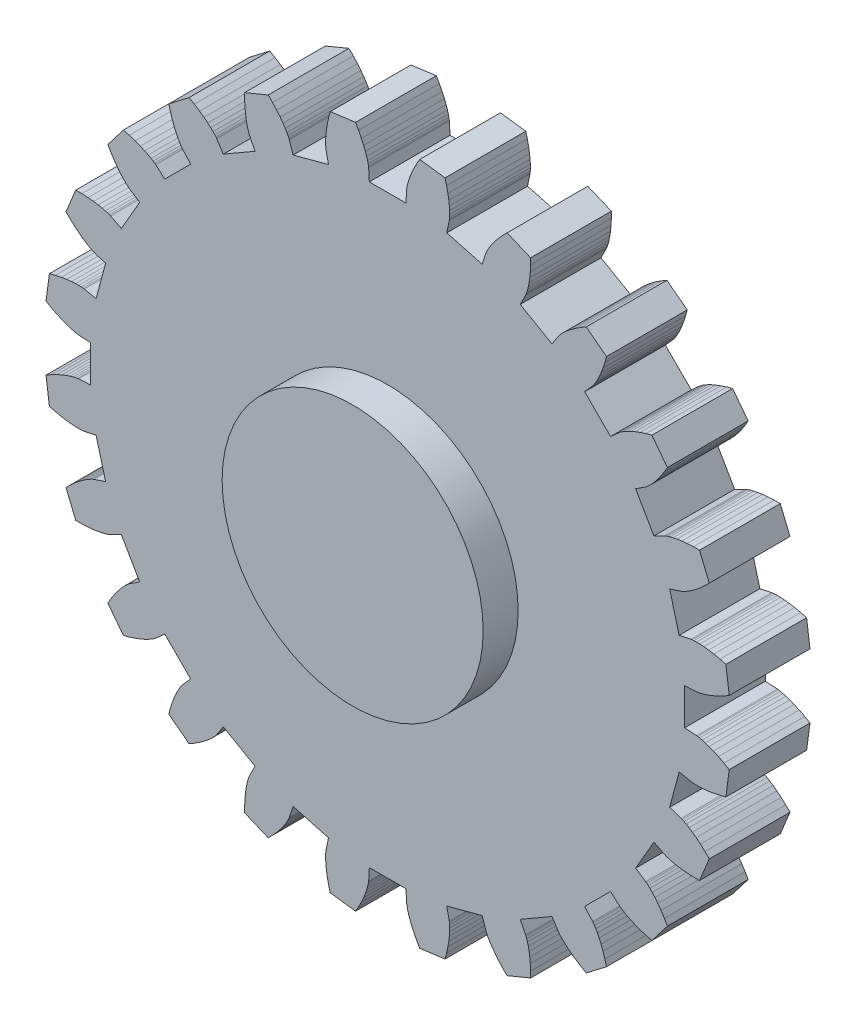
from build123d import *

# Parameters (mm, degrees)
MAIN_GEAR_BODY_DEPTH         = 3
CENTRAL_FEATURE_DEPTH        = 1.3
CENTRAL_FEATURE_DEPTH_BACK   = 4.3
SKETCH2_R                    = 5
SKETCH3_OUTSIDE_W            = 34.792
SKETCH3_OUTSIDE_H            = 34.792
TEETH_CLEARANCE_DEPTH        = 19.532451432
SKETCH4_R                    = 5
SKETCH4_R_2                  = 4.85
PRINT_CLEARANCE_TOP_DEPTH    = 1.3
PRINT_START                  = -1.3
SKETCH6_R                    = 5
SKETCH6_R_2                  = 4.85
PRINT_CLEARANCE_BOTTOM_DEPTH = 1.3


with BuildPart() as part:
    # Model → Main Gear Body (new body)
    with BuildSketch(Plane.XY):
        Polygon((11.481280763, -0.655890262), (11.081931867, -0.633076687), (11.081931867, 0.633076687), (11.481280763, 0.655890262), (11.494959484, 0.657119822), (11.535795525, 0.662587053), (11.603342457, 0.674939875), (11.696960474, 0.69678954), (11.81581907, 0.730698092), (11.958900465, 0.779166001), (12.125003794, 0.844620031), (12.312750022, 0.929401369), (12.520587586, 1.035754071), (12.746798737, 1.165813859), (12.614196933, 2.173024562), (12.36203179, 2.240104916), (12.133750014, 2.289041418), (11.930458058, 2.322341602), (11.753073814, 2.342574636), (11.602323381, 2.352358851), (11.478738615, 2.354349128), (11.382655444, 2.351224158), (11.314212973, 2.345673635), (11.273353363, 2.34038543), (11.259822499, 2.338032781), (10.868176499, 2.256709902), (10.540471892, 3.479720146), (10.920308717, 3.605115467), (10.933203113, 3.609843444), (10.971232676, 3.625693529), (11.033280856, 3.655107871), (11.118053808, 3.700443153), (11.224086216, 3.763959167), (11.349747813, 3.847807762), (11.493250558, 3.954022205), (11.652656464, 4.084506989), (11.82588603, 4.24102813), (12.010727273, 4.425203993), (11.621958453, 5.36377495), (11.361023956, 5.363304455), (11.127854994, 5.351489815), (10.922871322, 5.331039494), (10.746294605, 5.304672682), (10.598148527, 5.275106425), (10.478259688, 5.245042794), (10.386259274, 5.21715615), (10.321585504, 5.194080542), (10.28348684, 5.178397283), (10.27102594, 5.172622753), (9.913772864, 4.99270544), (9.280696176, 6.089226427), (9.615135678, 6.30865801), (9.626367017, 6.316562201), (9.658998451, 6.341714983), (9.711319399, 6.386186306), (9.781470148, 6.45191768), (9.867450435, 6.540712645), (9.967128604, 6.654227783), (10.078251291, 6.7939643), (10.198453625, 6.961260207), (10.325269884, 7.157283131), (10.456144594, 7.383023787), (9.837702711, 8.18899294), (9.585781114, 8.121003659), (9.363615046, 8.049243025), (9.170908956, 7.976435853), (9.007173178, 7.905266052), (8.871727365, 7.838364214), (8.76370468, 7.778295462), (8.682056698, 7.727547573), (8.625559041, 7.688519444), (8.592817683, 7.663509918), (8.582275936, 7.654707033), (8.28376199, 7.388456353), (7.388456353, 8.28376199), (7.654707033, 8.582275936), (7.663509918, 8.592817683), (7.688519444, 8.625559041), (7.727547573, 8.682056698), (7.778295462, 8.76370468), (7.838364214, 8.871727365), (7.905266052, 9.007173178), (7.976435853, 9.170908956), (8.049243025, 9.363615046), (8.121003659, 9.585781114), (8.18899294, 9.837702711), (7.383023787, 10.456144594), (7.157283131, 10.325269884), (6.961260207, 10.198453625), (6.7939643, 10.078251291), (6.654227783, 9.967128604), (6.540712645, 9.867450435), (6.45191768, 9.781470148), (6.386186306, 9.711319399), (6.341714983, 9.658998451), (6.316562201, 9.626367017), (6.30865801, 9.615135678), (6.089226427, 9.280696176), (4.99270544, 9.913772864), (5.172622753, 10.27102594), (5.178397283, 10.28348684), (5.194080542, 10.321585504), (5.21715615, 10.386259274), (5.245042794, 10.478259688), (5.275106425, 10.598148527), (5.304672682, 10.746294605), (5.331039494, 10.922871322), (5.351489815, 11.127854994), (5.363304455, 11.361023956), (5.36377495, 11.621958453), (4.425203993, 12.010727273), (4.24102813, 11.82588603), (4.084506989, 11.652656464), (3.954022205, 11.493250558), (3.847807762, 11.349747813), (3.763959167, 11.224086216), (3.700443153, 11.118053808), (3.655107871, 11.033280856), (3.625693529, 10.971232676), (3.609843444, 10.933203113), (3.605115467, 10.920308717), (3.479720146, 10.540471892), (2.256709902, 10.868176499), (2.338032781, 11.259822499), (2.34038543, 11.273353363), (2.345673635, 11.314212973), (2.351224158, 11.382655444), (2.354349128, 11.478738615), (2.352358851, 11.602323381), (2.342574636, 11.753073814), (2.322341602, 11.930458058), (2.289041418, 12.133750014), (2.240104916, 12.36203179), (2.173024562, 12.614196933), (1.165813859, 12.746798737), (1.035754071, 12.520587586), (0.929401369, 12.312750022), (0.844620031, 12.125003794), (0.779166001, 11.958900465), (0.730698092, 11.81581907), (0.69678954, 11.696960474), (0.674939875, 11.603342457), (0.662587053, 11.535795525), (0.657119822, 11.494959484), (0.655890262, 11.481280763), (0.633076687, 11.081931867), (-0.633076687, 11.081931867), (-0.655890262, 11.481280763), (-0.657119822, 11.494959484), (-0.662587053, 11.535795525), (-0.674939875, 11.603342457), (-0.69678954, 11.696960474), (-0.730698092, 11.81581907), (-0.779166001, 11.958900465), (-0.844620031, 12.125003794), (-0.929401369, 12.312750022), (-1.035754071, 12.520587586), (-1.165813859, 12.746798737), (-2.173024562, 12.614196933), (-2.240104916, 12.36203179), (-2.289041418, 12.133750014), (-2.322341602, 11.930458058), (-2.342574636, 11.753073814), (-2.352358851, 11.602323381), (-2.354349128, 11.478738615), (-2.351224158, 11.382655444), (-2.345673635, 11.314212973), (-2.34038543, 11.273353363), (-2.338032781, 11.259822499), (-2.256709902, 10.868176499), (-3.479720146, 10.540471892), (-3.605115467, 10.920308717), (-3.609843444, 10.933203113), (-3.625693529, 10.971232676), (-3.655107871, 11.033280856), (-3.700443153, 11.118053808), (-3.763959167, 11.224086216), (-3.847807762, 11.349747813), (-3.954022205, 11.493250558), (-4.084506989, 11.652656464), (-4.24102813, 11.82588603), (-4.425203993, 12.010727273), (-5.36377495, 11.621958453), (-5.363304455, 11.361023956), (-5.351489815, 11.127854994), (-5.331039494, 10.922871322), (-5.304672682, 10.746294605), (-5.275106425, 10.598148527), (-5.245042794, 10.478259688), (-5.21715615, 10.386259274), (-5.194080542, 10.321585504), (-5.178397283, 10.28348684), (-5.172622753, 10.27102594), (-4.99270544, 9.913772864), (-6.089226427, 9.280696176), (-6.30865801, 9.615135678), (-6.316562201, 9.626367017), (-6.341714983, 9.658998451), (-6.386186306, 9.711319399), (-6.45191768, 9.781470148), (-6.540712645, 9.867450435), (-6.654227783, 9.967128604), (-6.7939643, 10.078251291), (-6.961260207, 10.198453625), (-7.157283131, 10.325269884), (-7.383023787, 10.456144594), (-8.18899294, 9.837702711), (-8.121003659, 9.585781114), (-8.049243025, 9.363615046), (-7.976435853, 9.170908956), (-7.905266052, 9.007173178), (-7.838364214, 8.871727365), (-7.778295462, 8.76370468), (-7.727547573, 8.682056698), (-7.688519444, 8.625559041), (-7.663509918, 8.592817683), (-7.654707033, 8.582275936), (-7.388456353, 8.28376199), (-8.28376199, 7.388456353), (-8.582275936, 7.654707033), (-8.592817683, 7.663509918), (-8.625559041, 7.688519444), (-8.682056698, 7.727547573), (-8.76370468, 7.778295462), (-8.871727365, 7.838364214), (-9.007173178, 7.905266052), (-9.170908956, 7.976435853), (-9.363615046, 8.049243025), (-9.585781114, 8.121003659), (-9.837702711, 8.18899294), (-10.456144594, 7.383023787), (-10.325269884, 7.157283131), (-10.198453625, 6.961260207), (-10.078251291, 6.7939643), (-9.967128604, 6.654227783), (-9.867450435, 6.540712645), (-9.781470148, 6.45191768), (-9.711319399, 6.386186306), (-9.658998451, 6.341714983), (-9.626367017, 6.316562201), (-9.615135678, 6.30865801), (-9.280696176, 6.089226427), (-9.913772864, 4.99270544), (-10.27102594, 5.172622753), (-10.28348684, 5.178397283), (-10.321585504, 5.194080542), (-10.386259274, 5.21715615), (-10.478259688, 5.245042794), (-10.598148527, 5.275106425), (-10.746294605, 5.304672682), (-10.922871322, 5.331039494), (-11.127854994, 5.351489815), (-11.361023956, 5.363304455), (-11.621958453, 5.36377495), (-12.010727273, 4.425203993), (-11.82588603, 4.24102813), (-11.652656464, 4.084506989), (-11.493250558, 3.954022205), (-11.349747813, 3.847807762), (-11.224086216, 3.763959167), (-11.118053808, 3.700443153), (-11.033280856, 3.655107871), (-10.971232676, 3.625693529), (-10.933203113, 3.609843444), (-10.920308717, 3.605115467), (-10.540471892, 3.479720146), (-10.868176499, 2.256709902), (-11.259822499, 2.338032781), (-11.273353363, 2.34038543), (-11.314212973, 2.345673635), (-11.382655444, 2.351224158), (-11.478738615, 2.354349128), (-11.602323381, 2.352358851), (-11.753073814, 2.342574636), (-11.930458058, 2.322341602), (-12.133750014, 2.289041418), (-12.36203179, 2.240104916), (-12.614196933, 2.173024562), (-12.746798737, 1.165813859), (-12.520587586, 1.035754071), (-12.312750022, 0.929401369), (-12.125003794, 0.844620031), (-11.958900465, 0.779166001), (-11.81581907, 0.730698092), (-11.696960474, 0.69678954), (-11.603342457, 0.674939875), (-11.535795525, 0.662587053), (-11.494959484, 0.657119822), (-11.481280763, 0.655890262), (-11.081931867, 0.633076687), (-11.081931867, -0.633076687), (-11.481280763, -0.655890262), (-11.494959484, -0.657119822), (-11.535795525, -0.662587053), (-11.603342457, -0.674939875), (-11.696960474, -0.69678954), (-11.81581907, -0.730698092), (-11.958900465, -0.779166001), (-12.125003794, -0.844620031), (-12.312750022, -0.929401369), (-12.520587586, -1.035754071), (-12.746798737, -1.165813859), (-12.614196933, -2.173024562), (-12.36203179, -2.240104916), (-12.133750014, -2.289041418), (-11.930458058, -2.322341602), (-11.753073814, -2.342574636), (-11.602323381, -2.352358851), (-11.478738615, -2.354349128), (-11.382655444, -2.351224158), (-11.314212973, -2.345673635), (-11.273353363, -2.34038543), (-11.259822499, -2.338032781), (-10.868176499, -2.256709902), (-10.540471892, -3.479720146), (-10.920308717, -3.605115467), (-10.933203113, -3.609843444), (-10.971232676, -3.625693529), (-11.033280856, -3.655107871), (-11.118053808, -3.700443153), (-11.224086216, -3.763959167), (-11.349747813, -3.847807762), (-11.493250558, -3.954022205), (-11.652656464, -4.084506989), (-11.82588603, -4.24102813), (-12.010727273, -4.425203993), (-11.621958453, -5.36377495), (-11.361023956, -5.363304455), (-11.127854994, -5.351489815), (-10.922871322, -5.331039494), (-10.746294605, -5.304672682), (-10.598148527, -5.275106425), (-10.478259688, -5.245042794), (-10.386259274, -5.21715615), (-10.321585504, -5.194080542), (-10.28348684, -5.178397283), (-10.27102594, -5.172622753), (-9.913772864, -4.99270544), (-9.280696176, -6.089226427), (-9.615135678, -6.30865801), (-9.626367017, -6.316562201), (-9.658998451, -6.341714983), (-9.711319399, -6.386186306), (-9.781470148, -6.45191768), (-9.867450435, -6.540712645), (-9.967128604, -6.654227783), (-10.078251291, -6.7939643), (-10.198453625, -6.961260207), (-10.325269884, -7.157283131), (-10.456144594, -7.383023787), (-9.837702711, -8.18899294), (-9.585781114, -8.121003659), (-9.363615046, -8.049243025), (-9.170908956, -7.976435853), (-9.007173178, -7.905266052), (-8.871727365, -7.838364214), (-8.76370468, -7.778295462), (-8.682056698, -7.727547573), (-8.625559041, -7.688519444), (-8.592817683, -7.663509918), (-8.582275936, -7.654707033), (-8.28376199, -7.388456353), (-7.388456353, -8.28376199), (-7.654707033, -8.582275936), (-7.663509918, -8.592817683), (-7.688519444, -8.625559041), (-7.727547573, -8.682056698), (-7.778295462, -8.76370468), (-7.838364214, -8.871727365), (-7.905266052, -9.007173178), (-7.976435853, -9.170908956), (-8.049243025, -9.363615046), (-8.121003659, -9.585781114), (-8.18899294, -9.837702711), (-7.383023787, -10.456144594), (-7.157283131, -10.325269884), (-6.961260207, -10.198453625), (-6.7939643, -10.078251291), (-6.654227783, -9.967128604), (-6.540712645, -9.867450435), (-6.45191768, -9.781470148), (-6.386186306, -9.711319399), (-6.341714983, -9.658998451), (-6.316562201, -9.626367017), (-6.30865801, -9.615135678), (-6.089226427, -9.280696176), (-4.99270544, -9.913772864), (-5.172622753, -10.27102594), (-5.178397283, -10.28348684), (-5.194080542, -10.321585504), (-5.21715615, -10.386259274), (-5.245042794, -10.478259688), (-5.275106425, -10.598148527), (-5.304672682, -10.746294605), (-5.331039494, -10.922871322), (-5.351489815, -11.127854994), (-5.363304455, -11.361023956), (-5.36377495, -11.621958453), (-4.425203993, -12.010727273), (-4.24102813, -11.82588603), (-4.084506989, -11.652656464), (-3.954022205, -11.493250558), (-3.847807762, -11.349747813), (-3.763959167, -11.224086216), (-3.700443153, -11.118053808), (-3.655107871, -11.033280856), (-3.625693529, -10.971232676), (-3.609843444, -10.933203113), (-3.605115467, -10.920308717), (-3.479720146, -10.540471892), (-2.256709902, -10.868176499), (-2.338032781, -11.259822499), (-2.34038543, -11.273353363), (-2.345673635, -11.314212973), (-2.351224158, -11.382655444), (-2.354349128, -11.478738615), (-2.352358851, -11.602323381), (-2.342574636, -11.753073814), (-2.322341602, -11.930458058), (-2.289041418, -12.133750014), (-2.240104916, -12.36203179), (-2.173024562, -12.614196933), (-1.165813859, -12.746798737), (-1.035754071, -12.520587586), (-0.929401369, -12.312750022), (-0.844620031, -12.125003794), (-0.779166001, -11.958900465), (-0.730698092, -11.81581907), (-0.69678954, -11.696960474), (-0.674939875, -11.603342457), (-0.662587053, -11.535795525), (-0.657119822, -11.494959484), (-0.655890262, -11.481280763), (-0.633076687, -11.081931867), (0.633076687, -11.081931867), (0.655890262, -11.481280763), (0.657119822, -11.494959484), (0.662587053, -11.535795525), (0.674939875, -11.603342457), (0.69678954, -11.696960474), (0.730698092, -11.81581907), (0.779166001, -11.958900465), (0.844620031, -12.125003794), (0.929401369, -12.312750022), (1.035754071, -12.520587586), (1.165813859, -12.746798737), (2.173024562, -12.614196933), (2.240104916, -12.36203179), (2.289041418, -12.133750014), (2.322341602, -11.930458058), (2.342574636, -11.753073814), (2.352358851, -11.602323381), (2.354349128, -11.478738615), (2.351224158, -11.382655444), (2.345673635, -11.314212973), (2.34038543, -11.273353363), (2.338032781, -11.259822499), (2.256709902, -10.868176499), (3.479720146, -10.540471892), (3.605115467, -10.920308717), (3.609843444, -10.933203113), (3.625693529, -10.971232676), (3.655107871, -11.033280856), (3.700443153, -11.118053808), (3.763959167, -11.224086216), (3.847807762, -11.349747813), (3.954022205, -11.493250558), (4.084506989, -11.652656464), (4.24102813, -11.82588603), (4.425203993, -12.010727273), (5.36377495, -11.621958453), (5.363304455, -11.361023956), (5.351489815, -11.127854994), (5.331039494, -10.922871322), (5.304672682, -10.746294605), (5.275106425, -10.598148527), (5.245042794, -10.478259688), (5.21715615, -10.386259274), (5.194080542, -10.321585504), (5.178397283, -10.28348684), (5.172622753, -10.27102594), (4.99270544, -9.913772864), (6.089226427, -9.280696176), (6.30865801, -9.615135678), (6.316562201, -9.626367017), (6.341714983, -9.658998451), (6.386186306, -9.711319399), (6.45191768, -9.781470148), (6.540712645, -9.867450435), (6.654227783, -9.967128604), (6.7939643, -10.078251291), (6.961260207, -10.198453625), (7.157283131, -10.325269884), (7.383023787, -10.456144594), (8.18899294, -9.837702711), (8.121003659, -9.585781114), (8.049243025, -9.363615046), (7.976435853, -9.170908956), (7.905266052, -9.007173178), (7.838364214, -8.871727365), (7.778295462, -8.76370468), (7.727547573, -8.682056698), (7.688519444, -8.625559041), (7.663509918, -8.592817683), (7.654707033, -8.582275936), (7.388456353, -8.28376199), (8.28376199, -7.388456353), (8.582275936, -7.654707033), (8.592817683, -7.663509918), (8.625559041, -7.688519444), (8.682056698, -7.727547573), (8.76370468, -7.778295462), (8.871727365, -7.838364214), (9.007173178, -7.905266052), (9.170908956, -7.976435853), (9.363615046, -8.049243025), (9.585781114, -8.121003659), (9.837702711, -8.18899294), (10.456144594, -7.383023787), (10.325269884, -7.157283131), (10.198453625, -6.961260207), (10.078251291, -6.7939643), (9.967128604, -6.654227783), (9.867450435, -6.540712645), (9.781470148, -6.45191768), (9.711319399, -6.386186306), (9.658998451, -6.341714983), (9.626367017, -6.316562201), (9.615135678, -6.30865801), (9.280696176, -6.089226427), (9.913772864, -4.99270544), (10.27102594, -5.172622753), (10.28348684, -5.178397283), (10.321585504, -5.194080542), (10.386259274, -5.21715615), (10.478259688, -5.245042794), (10.598148527, -5.275106425), (10.746294605, -5.304672682), (10.922871322, -5.331039494), (11.127854994, -5.351489815), (11.361023956, -5.363304455), (11.621958453, -5.36377495), (12.010727273, -4.425203993), (11.82588603, -4.24102813), (11.652656464, -4.084506989), (11.493250558, -3.954022205), (11.349747813, -3.847807762), (11.224086216, -3.763959167), (11.118053808, -3.700443153), (11.033280856, -3.655107871), (10.971232676, -3.625693529), (10.933203113, -3.609843444), (10.920308717, -3.605115467), (10.540471892, -3.479720146), (10.868176499, -2.256709902), (11.259822499, -2.338032781), (11.273353363, -2.34038543), (11.314212973, -2.345673635), (11.382655444, -2.351224158), (11.478738615, -2.354349128), (11.602323381, -2.352358851), (11.753073814, -2.342574636), (11.930458058, -2.322341602), (12.133750014, -2.289041418), (12.36203179, -2.240104916), (12.614196933, -2.173024562), (12.746798737, -1.165813859), (12.520587586, -1.035754071), (12.312750022, -0.929401369), (12.125003794, -0.844620031), (11.958900465, -0.779166001), (11.81581907, -0.730698092), (11.696960474, -0.69678954), (11.603342457, -0.674939875), (11.535795525, -0.662587053), (11.494959484, -0.657119822), align=None)
    extrude(amount=MAIN_GEAR_BODY_DEPTH)

    # Sketch2 → Central Feature (add, two sides: drawn at the far end of the back side and taken through both)
    with BuildSketch(Plane.XY.offset(3).offset(-CENTRAL_FEATURE_DEPTH_BACK)):
        with Locations(Location((0, 0, 0), (0, 0, 180))):
            Circle(SKETCH2_R)
    extrude(amount=CENTRAL_FEATURE_DEPTH + CENTRAL_FEATURE_DEPTH_BACK)

    # Sketch3 outside → Teeth Clearance (cut, through all)
    with BuildSketch(Plane(origin=(0, 0, 0), x_dir=(-1, 0, 0), z_dir=(0, 0, -1))):
        Rectangle(SKETCH3_OUTSIDE_W, SKETCH3_OUTSIDE_H)
        Polygon((-11.477615752, -0.705762411), (-11.489401209, -0.706821789), (-11.527976246, -0.711986312), (-11.59315705, -0.723906422), (-11.684412493, -0.745204681), (-11.800930862, -0.778445602), (-11.941703887, -0.826131565), (-12.105537815, -0.890691324), (-12.291059816, -0.974468259), (-12.496724072, -1.079708856), (-12.692857237, -1.192475348), (-12.568993946, -2.133310454), (-12.35035774, -2.191471522), (-12.124463053, -2.239896306), (-11.923579494, -2.272801984), (-11.748618777, -2.292758582), (-11.600300442, -2.302384946), (-11.479148956, -2.304336036), (-11.385490572, -2.301289929), (-11.319445598, -2.295933837), (-11.280848297, -2.290938429), (-11.269190232, -2.288911409), (-10.832102983, -2.198152934), (-10.479952826, -3.512395209), (-10.903860726, -3.652339689), (-10.914970416, -3.656413271), (-10.950894363, -3.67138577), (-11.010769034, -3.699769746), (-11.093402628, -3.743960931), (-11.197347347, -3.806226368), (-11.320981611, -3.888722212), (-11.462523738, -3.993485491), (-11.620041165, -4.122424424), (-11.79145931, -4.27730886), (-11.951723284, -4.436995926), (-11.588574488, -5.313714674), (-11.362334938, -5.313306738), (-11.13160417, -5.30161564), (-10.929048936, -5.281407594), (-10.754884713, -5.255401021), (-10.609128716, -5.226311764), (-10.491600388, -5.196840061), (-10.401921726, -5.169657174), (-10.339513439, -5.14738989), (-10.303524216, -5.132574979), (-10.292788022, -5.127599699), (-9.894084181, -4.926807239), (-9.213782319, -6.105124628), (-9.58702561, -6.350016053), (-9.596702427, -6.35682623), (-9.627527127, -6.380586356), (-9.678015304, -6.423499876), (-9.746395706, -6.487572431), (-9.830683114, -6.574619098), (-9.928753148, -6.686302866), (-10.038357612, -6.824130221), (-10.157135911, -6.989444176), (-10.282626082, -7.183417334), (-10.39609914, -7.379142564), (-9.81841283, -8.13199802), (-9.599987788, -8.07304888), (-9.380144858, -8.00203863), (-9.189721754, -7.930094003), (-9.028223029, -7.859896565), (-8.894962401, -7.794074073), (-8.789066591, -7.735188024), (-8.709479105, -7.685720826), (-8.654960526, -7.648059828), (-8.624031987, -7.624435026), (-8.614949317, -7.616850543), (-8.281799893, -7.319707773), (-7.319707773, -8.281799893), (-7.616850543, -8.614949317), (-7.624435026, -8.624031987), (-7.648059828, -8.654960526), (-7.685720826, -8.709479105), (-7.735188024, -8.789066591), (-7.794074073, -8.894962401), (-7.859896565, -9.028223029), (-7.930094003, -9.189721754), (-8.00203863, -9.380144858), (-8.07304888, -9.599987788), (-8.13199802, -9.81841283), (-7.379142564, -10.39609914), (-7.183417334, -10.282626082), (-6.989444176, -10.157135911), (-6.824130221, -10.038357612), (-6.686302866, -9.928753148), (-6.574619098, -9.830683114), (-6.487572431, -9.746395706), (-6.423499876, -9.678015304), (-6.380586356, -9.627527127), (-6.35682623, -9.596702427), (-6.350016053, -9.58702561), (-6.105124628, -9.213782319), (-4.926807239, -9.894084181), (-5.127599699, -10.292788022), (-5.132574979, -10.303524216), (-5.14738989, -10.339513439), (-5.169657174, -10.401921726), (-5.196840061, -10.491600388), (-5.226311764, -10.609128716), (-5.255401021, -10.754884713), (-5.281407594, -10.929048936), (-5.30161564, -11.13160417), (-5.313306738, -11.362334938), (-5.313714674, -11.588574488), (-4.436995926, -11.951723284), (-4.27730886, -11.79145931), (-4.122424424, -11.620041165), (-3.993485491, -11.462523738), (-3.888722212, -11.320981611), (-3.806226368, -11.197347347), (-3.743960931, -11.093402628), (-3.699769746, -11.010769034), (-3.67138577, -10.950894363), (-3.656413271, -10.914970416), (-3.652339689, -10.903860726), (-3.512395209, -10.479952826), (-2.198152934, -10.832102983), (-2.288911409, -11.269190232), (-2.290938429, -11.280848297), (-2.295933837, -11.319445598), (-2.301289929, -11.385490572), (-2.304336036, -11.479148956), (-2.302384946, -11.600300442), (-2.292758582, -11.748618777), (-2.272801984, -11.923579494), (-2.239896306, -12.124463053), (-2.191471522, -12.35035774), (-2.133310454, -12.568993946), (-1.192475348, -12.692857237), (-1.079708856, -12.496724072), (-0.974468259, -12.291059816), (-0.890691324, -12.105537815), (-0.826131565, -11.941703887), (-0.778445602, -11.800930862), (-0.745204681, -11.684412493), (-0.723906422, -11.59315705), (-0.711986312, -11.527976246), (-0.706821789, -11.489401209), (-0.705762411, -11.477615752), (-0.680301862, -11.031931867), (0.680301862, -11.031931867), (0.705762411, -11.477615752), (0.706821789, -11.489401209), (0.711986312, -11.527976246), (0.723906422, -11.59315705), (0.745204681, -11.684412493), (0.778445602, -11.800930862), (0.826131565, -11.941703887), (0.890691324, -12.105537815), (0.974468259, -12.291059816), (1.079708856, -12.496724072), (1.192475348, -12.692857237), (2.133310454, -12.568993946), (2.191471522, -12.35035774), (2.239896306, -12.124463053), (2.272801984, -11.923579494), (2.292758582, -11.748618777), (2.302384946, -11.600300442), (2.304336036, -11.479148956), (2.301289929, -11.385490572), (2.295933837, -11.319445598), (2.290938429, -11.280848297), (2.288911409, -11.269190232), (2.198152934, -10.832102983), (3.512395209, -10.479952826), (3.652339689, -10.903860726), (3.656413271, -10.914970416), (3.67138577, -10.950894363), (3.699769746, -11.010769034), (3.743960931, -11.093402628), (3.806226368, -11.197347347), (3.888722212, -11.320981611), (3.993485491, -11.462523738), (4.122424424, -11.620041165), (4.27730886, -11.79145931), (4.436995926, -11.951723284), (5.313714674, -11.588574488), (5.313306738, -11.362334938), (5.30161564, -11.13160417), (5.281407594, -10.929048936), (5.255401021, -10.754884713), (5.226311764, -10.609128716), (5.196840061, -10.491600388), (5.169657174, -10.401921726), (5.14738989, -10.339513439), (5.132574979, -10.303524216), (5.127599699, -10.292788022), (4.926807239, -9.894084181), (6.105124628, -9.213782319), (6.350016053, -9.58702561), (6.35682623, -9.596702427), (6.380586356, -9.627527127), (6.423499876, -9.678015304), (6.487572431, -9.746395706), (6.574619098, -9.830683114), (6.686302866, -9.928753148), (6.824130221, -10.038357612), (6.989444176, -10.157135911), (7.183417334, -10.282626082), (7.379142564, -10.39609914), (8.13199802, -9.81841283), (8.07304888, -9.599987788), (8.00203863, -9.380144858), (7.930094003, -9.189721754), (7.859896565, -9.028223029), (7.794074073, -8.894962401), (7.735188024, -8.789066591), (7.685720826, -8.709479105), (7.648059828, -8.654960526), (7.624435026, -8.624031987), (7.616850543, -8.614949317), (7.319707773, -8.281799893), (8.281799893, -7.319707773), (8.614949317, -7.616850543), (8.624031987, -7.624435026), (8.654960526, -7.648059828), (8.709479105, -7.685720826), (8.789066591, -7.735188024), (8.894962401, -7.794074073), (9.028223029, -7.859896565), (9.189721754, -7.930094003), (9.380144858, -8.00203863), (9.599987788, -8.07304888), (9.81841283, -8.13199802), (10.39609914, -7.379142564), (10.282626082, -7.183417334), (10.157135911, -6.989444176), (10.038357612, -6.824130221), (9.928753148, -6.686302866), (9.830683114, -6.574619098), (9.746395706, -6.487572431), (9.678015304, -6.423499876), (9.627527127, -6.380586356), (9.596702427, -6.35682623), (9.58702561, -6.350016053), (9.213782319, -6.105124628), (9.894084181, -4.926807239), (10.292788022, -5.127599699), (10.303524216, -5.132574979), (10.339513439, -5.14738989), (10.401921726, -5.169657174), (10.491600388, -5.196840061), (10.609128716, -5.226311764), (10.754884713, -5.255401021), (10.929048936, -5.281407594), (11.13160417, -5.30161564), (11.362334938, -5.313306738), (11.588574488, -5.313714674), (11.951723284, -4.436995926), (11.79145931, -4.27730886), (11.620041165, -4.122424424), (11.462523738, -3.993485491), (11.320981611, -3.888722212), (11.197347347, -3.806226368), (11.093402628, -3.743960931), (11.010769034, -3.699769746), (10.950894363, -3.67138577), (10.914970416, -3.656413271), (10.903860726, -3.652339689), (10.479952826, -3.512395209), (10.832102983, -2.198152934), (11.269190232, -2.288911409), (11.280848297, -2.290938429), (11.319445598, -2.295933837), (11.385490572, -2.301289929), (11.479148956, -2.304336036), (11.600300442, -2.302384946), (11.748618777, -2.292758582), (11.923579494, -2.272801984), (12.124463053, -2.239896306), (12.35035774, -2.191471522), (12.568993946, -2.133310454), (12.692857237, -1.192475348), (12.496724072, -1.079708856), (12.291059816, -0.974468259), (12.105537815, -0.890691324), (11.941703887, -0.826131565), (11.800930862, -0.778445602), (11.684412493, -0.745204681), (11.59315705, -0.723906422), (11.527976246, -0.711986312), (11.489401209, -0.706821789), (11.477615752, -0.705762411), (11.031931867, -0.680301862), (11.031931867, 0.680301862), (11.477615752, 0.705762411), (11.489401209, 0.706821789), (11.527976246, 0.711986312), (11.59315705, 0.723906422), (11.684412493, 0.745204681), (11.800930862, 0.778445602), (11.941703887, 0.826131565), (12.105537815, 0.890691324), (12.291059816, 0.974468259), (12.496724072, 1.079708856), (12.692857237, 1.192475348), (12.568993946, 2.133310454), (12.35035774, 2.191471522), (12.124463053, 2.239896306), (11.923579494, 2.272801984), (11.748618777, 2.292758582), (11.600300442, 2.302384946), (11.479148956, 2.304336036), (11.385490572, 2.301289929), (11.319445598, 2.295933837), (11.280848297, 2.290938429), (11.269190232, 2.288911409), (10.832102983, 2.198152934), (10.479952826, 3.512395209), (10.903860726, 3.652339689), (10.914970416, 3.656413271), (10.950894363, 3.67138577), (11.010769034, 3.699769746), (11.093402628, 3.743960931), (11.197347347, 3.806226368), (11.320981611, 3.888722212), (11.462523738, 3.993485491), (11.620041165, 4.122424424), (11.79145931, 4.27730886), (11.951723284, 4.436995926), (11.588574488, 5.313714674), (11.362334938, 5.313306738), (11.13160417, 5.30161564), (10.929048936, 5.281407594), (10.754884713, 5.255401021), (10.609128716, 5.226311764), (10.491600388, 5.196840061), (10.401921726, 5.169657174), (10.339513439, 5.14738989), (10.303524216, 5.132574979), (10.292788022, 5.127599699), (9.894084181, 4.926807239), (9.213782319, 6.105124628), (9.58702561, 6.350016053), (9.596702427, 6.35682623), (9.627527127, 6.380586356), (9.678015304, 6.423499876), (9.746395706, 6.487572431), (9.830683114, 6.574619098), (9.928753148, 6.686302866), (10.038357612, 6.824130221), (10.157135911, 6.989444176), (10.282626082, 7.183417334), (10.39609914, 7.379142564), (9.81841283, 8.13199802), (9.599987788, 8.07304888), (9.380144858, 8.00203863), (9.189721754, 7.930094003), (9.028223029, 7.859896565), (8.894962401, 7.794074073), (8.789066591, 7.735188024), (8.709479105, 7.685720826), (8.654960526, 7.648059828), (8.624031987, 7.624435026), (8.614949317, 7.616850543), (8.281799893, 7.319707773), (7.319707773, 8.281799893), (7.616850543, 8.614949317), (7.624435026, 8.624031987), (7.648059828, 8.654960526), (7.685720826, 8.709479105), (7.735188024, 8.789066591), (7.794074073, 8.894962401), (7.859896565, 9.028223029), (7.930094003, 9.189721754), (8.00203863, 9.380144858), (8.07304888, 9.599987788), (8.13199802, 9.81841283), (7.379142564, 10.39609914), (7.183417334, 10.282626082), (6.989444176, 10.157135911), (6.824130221, 10.038357612), (6.686302866, 9.928753148), (6.574619098, 9.830683114), (6.487572431, 9.746395706), (6.423499876, 9.678015304), (6.380586356, 9.627527127), (6.35682623, 9.596702427), (6.350016053, 9.58702561), (6.105124628, 9.213782319), (4.926807239, 9.894084181), (5.127599699, 10.292788022), (5.132574979, 10.303524216), (5.14738989, 10.339513439), (5.169657174, 10.401921726), (5.196840061, 10.491600388), (5.226311764, 10.609128716), (5.255401021, 10.754884713), (5.281407594, 10.929048936), (5.30161564, 11.13160417), (5.313306738, 11.362334938), (5.313714674, 11.588574488), (4.436995926, 11.951723284), (4.27730886, 11.79145931), (4.122424424, 11.620041165), (3.993485491, 11.462523738), (3.888722212, 11.320981611), (3.806226368, 11.197347347), (3.743960931, 11.093402628), (3.699769746, 11.010769034), (3.67138577, 10.950894363), (3.656413271, 10.914970416), (3.652339689, 10.903860726), (3.512395209, 10.479952826), (2.198152934, 10.832102983), (2.288911409, 11.269190232), (2.290938429, 11.280848297), (2.295933837, 11.319445598), (2.301289929, 11.385490572), (2.304336036, 11.479148956), (2.302384946, 11.600300442), (2.292758582, 11.748618777), (2.272801984, 11.923579494), (2.239896306, 12.124463053), (2.191471522, 12.35035774), (2.133310454, 12.568993946), (1.192475348, 12.692857237), (1.079708856, 12.496724072), (0.974468259, 12.291059816), (0.890691324, 12.105537815), (0.826131565, 11.941703887), (0.778445602, 11.800930862), (0.745204681, 11.684412493), (0.723906422, 11.59315705), (0.711986312, 11.527976246), (0.706821789, 11.489401209), (0.705762411, 11.477615752), (0.680301862, 11.031931867), (-0.680301862, 11.031931867), (-0.705762411, 11.477615752), (-0.706821789, 11.489401209), (-0.711986312, 11.527976246), (-0.723906422, 11.59315705), (-0.745204681, 11.684412493), (-0.778445602, 11.800930862), (-0.826131565, 11.941703887), (-0.890691324, 12.105537815), (-0.974468259, 12.291059816), (-1.079708856, 12.496724072), (-1.192475348, 12.692857237), (-2.133310454, 12.568993946), (-2.191471522, 12.35035774), (-2.239896306, 12.124463053), (-2.272801984, 11.923579494), (-2.292758582, 11.748618777), (-2.302384946, 11.600300442), (-2.304336036, 11.479148956), (-2.301289929, 11.385490572), (-2.295933837, 11.319445598), (-2.290938429, 11.280848297), (-2.288911409, 11.269190232), (-2.198152934, 10.832102983), (-3.512395209, 10.479952826), (-3.652339689, 10.903860726), (-3.656413271, 10.914970416), (-3.67138577, 10.950894363), (-3.699769746, 11.010769034), (-3.743960931, 11.093402628), (-3.806226368, 11.197347347), (-3.888722212, 11.320981611), (-3.993485491, 11.462523738), (-4.122424424, 11.620041165), (-4.27730886, 11.79145931), (-4.436995926, 11.951723284), (-5.313714674, 11.588574488), (-5.313306738, 11.362334938), (-5.30161564, 11.13160417), (-5.281407594, 10.929048936), (-5.255401021, 10.754884713), (-5.226311764, 10.609128716), (-5.196840061, 10.491600388), (-5.169657174, 10.401921726), (-5.14738989, 10.339513439), (-5.132574979, 10.303524216), (-5.127599699, 10.292788022), (-4.926807239, 9.894084181), (-6.105124628, 9.213782319), (-6.350016053, 9.58702561), (-6.35682623, 9.596702427), (-6.380586356, 9.627527127), (-6.423499876, 9.678015304), (-6.487572431, 9.746395706), (-6.574619098, 9.830683114), (-6.686302866, 9.928753148), (-6.824130221, 10.038357612), (-6.989444176, 10.157135911), (-7.183417334, 10.282626082), (-7.379142564, 10.39609914), (-8.13199802, 9.81841283), (-8.07304888, 9.599987788), (-8.00203863, 9.380144858), (-7.930094003, 9.189721754), (-7.859896565, 9.028223029), (-7.794074073, 8.894962401), (-7.735188024, 8.789066591), (-7.685720826, 8.709479105), (-7.648059828, 8.654960526), (-7.624435026, 8.624031987), (-7.616850543, 8.614949317), (-7.319707773, 8.281799893), (-8.281799893, 7.319707773), (-8.614949317, 7.616850543), (-8.624031987, 7.624435026), (-8.654960526, 7.648059828), (-8.709479105, 7.685720826), (-8.789066591, 7.735188024), (-8.894962401, 7.794074073), (-9.028223029, 7.859896565), (-9.189721754, 7.930094003), (-9.380144858, 8.00203863), (-9.599987788, 8.07304888), (-9.81841283, 8.13199802), (-10.39609914, 7.379142564), (-10.282626082, 7.183417334), (-10.157135911, 6.989444176), (-10.038357612, 6.824130221), (-9.928753148, 6.686302866), (-9.830683114, 6.574619098), (-9.746395706, 6.487572431), (-9.678015304, 6.423499876), (-9.627527127, 6.380586356), (-9.596702427, 6.35682623), (-9.58702561, 6.350016053), (-9.213782319, 6.105124628), (-9.894084181, 4.926807239), (-10.292788022, 5.127599699), (-10.303524216, 5.132574979), (-10.339513439, 5.14738989), (-10.401921726, 5.169657174), (-10.491600388, 5.196840061), (-10.609128716, 5.226311764), (-10.754884713, 5.255401021), (-10.929048936, 5.281407594), (-11.13160417, 5.30161564), (-11.362334938, 5.313306738), (-11.588574488, 5.313714674), (-11.951723284, 4.436995926), (-11.79145931, 4.27730886), (-11.620041165, 4.122424424), (-11.462523738, 3.993485491), (-11.320981611, 3.888722212), (-11.197347347, 3.806226368), (-11.093402628, 3.743960931), (-11.010769034, 3.699769746), (-10.950894363, 3.67138577), (-10.914970416, 3.656413271), (-10.903860726, 3.652339689), (-10.479952826, 3.512395209), (-10.832102983, 2.198152934), (-11.269190232, 2.288911409), (-11.280848297, 2.290938429), (-11.319445598, 2.295933837), (-11.385490572, 2.301289929), (-11.479148956, 2.304336036), (-11.600300442, 2.302384946), (-11.748618777, 2.292758582), (-11.923579494, 2.272801984), (-12.124463053, 2.239896306), (-12.35035774, 2.191471522), (-12.568993946, 2.133310454), (-12.692857237, 1.192475348), (-12.496724072, 1.079708856), (-12.291059816, 0.974468259), (-12.105537815, 0.890691324), (-11.941703887, 0.826131565), (-11.800930862, 0.778445602), (-11.684412493, 0.745204681), (-11.59315705, 0.723906422), (-11.527976246, 0.711986312), (-11.489401209, 0.706821789), (-11.477615752, 0.705762411), (-11.031931867, 0.680301862), (-11.031931867, -0.680301862), align=None, mode=Mode.SUBTRACT)
    extrude(amount=-TEETH_CLEARANCE_DEPTH, mode=Mode.SUBTRACT)

    # Sketch4 → Print Clearance - Top (cut)
    with BuildSketch(Plane(origin=(0, 0, -1.3), x_dir=(-1, 0, 0), z_dir=(0, 0, -1))):
        with Locations(Location((0, 0, 0), (0, 0, 180))):
            Circle(SKETCH4_R)
        Circle(SKETCH4_R_2, mode=Mode.SUBTRACT)
    extrude(amount=-PRINT_CLEARANCE_TOP_DEPTH, mode=Mode.SUBTRACT)

    # Sketch6 → Print Clearance - Bottom (cut)
    with BuildSketch(Plane.XY.offset(4.3).offset(PRINT_START)):
        Circle(SKETCH6_R)
        with Locations(Location((0, 0, 0), (0, 0, 180))):
            Circle(SKETCH6_R_2, mode=Mode.SUBTRACT)
    extrude(amount=PRINT_CLEARANCE_BOTTOM_DEPTH, mode=Mode.SUBTRACT)


solid = part.part
